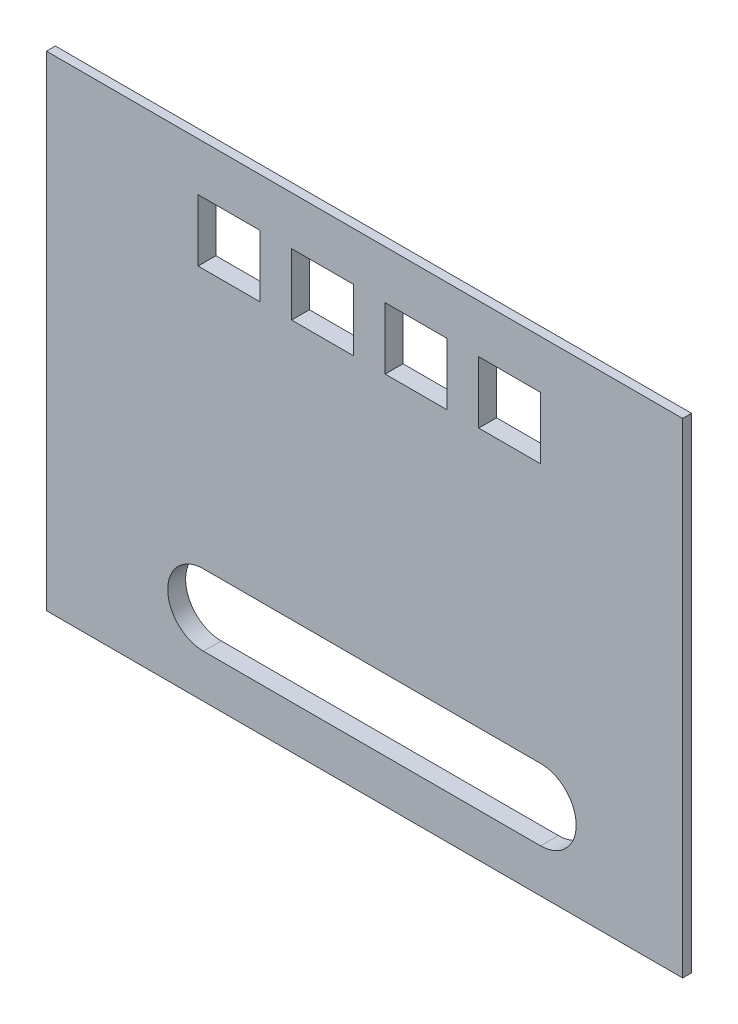
from build123d import *

# Parameters (mm, degrees)
SKETCH_1_W                                = 101
SKETCH_1_H                                = 74
EXTRUDE_1_DEPTH                           = 3
EXTRUDE_START                             = 1.5
SKETCH_2_W                                = 107
SKETCH_2_H                                = 80
EXTRUDE_2_DEPTH                           = 1.5
SKETCH_3_W                                = 10.4
SKETCH_3_H                                = 10.4
CUT_EXTRUDE_1_DEPTH                       = 5
SKETCH_4_W                                = 101
SKETCH_4_H                                = 1.5
TOP_REAR_INNER_EXTENSION_1P5MM_DEPTH      = 3
TOP_REAR_OUTER_SKIN_EXTENSION_1P5MM_START = 1.5
SKETCH_5_W                                = 107
SKETCH_5_H                                = 1.5
TOP_REAR_OUTER_SKIN_EXTENSION_1P5MM_DEPTH = 1.5


with BuildPart() as part:
    # Эскиз1 → Бобышка-Вытянуть1 (new body)
    with BuildSketch(Plane.XY):
        with Locations((53.5, 40)):
            Rectangle(SKETCH_1_W, SKETCH_1_H)
    extrude(amount=EXTRUDE_1_DEPTH)

    # Эскиз2 → Бобышка-Вытянуть2 (add)
    with BuildSketch(Plane.XY.offset(EXTRUDE_START)):
        with Locations((53.5, 40)):
            Rectangle(SKETCH_2_W, SKETCH_2_H)
    extrude(amount=EXTRUDE_2_DEPTH)

    # Эскиз3 → Вырез-Вытянуть1 (cut)
    with BuildSketch(Plane.XY.offset(3)):
        with Locations((30.7, 68.15)):
            Rectangle(SKETCH_3_W, SKETCH_3_H)
        with Locations((46.433, 68.15)):
            Rectangle(SKETCH_3_W, SKETCH_3_H)
        with Locations((62.167, 68.15)):
            Rectangle(SKETCH_3_W, SKETCH_3_H)
        with Locations((77.9, 68.15)):
            Rectangle(SKETCH_3_W, SKETCH_3_H)
        with BuildLine():
            Line((26.4, 19.3), (83.1, 19.3))
            ThreePointArc((83.1, 19.3), (89.1, 13.3), (83.1, 7.3))
            Line((83.1, 7.3), (26.4, 7.3))
            ThreePointArc((26.4, 7.3), (20.4, 13.3), (26.4, 19.3))
        make_face()
    extrude(amount=-CUT_EXTRUDE_1_DEPTH, mode=Mode.SUBTRACT)

    # Эскиз4 → top_rear_inner_extension_1p5mm (add)
    with BuildSketch(Plane.XY):
        with Locations((53.5, 77.75)):
            Rectangle(SKETCH_4_W, SKETCH_4_H)
    extrude(amount=TOP_REAR_INNER_EXTENSION_1P5MM_DEPTH)

    # Эскиз5 → top_rear_outer_skin_extension_1p5mm (add)
    with BuildSketch(Plane.XY.offset(TOP_REAR_OUTER_SKIN_EXTENSION_1P5MM_START)):
        with Locations((53.5, 80.75)):
            Rectangle(SKETCH_5_W, SKETCH_5_H)
    extrude(amount=TOP_REAR_OUTER_SKIN_EXTENSION_1P5MM_DEPTH)


solid = part.part
